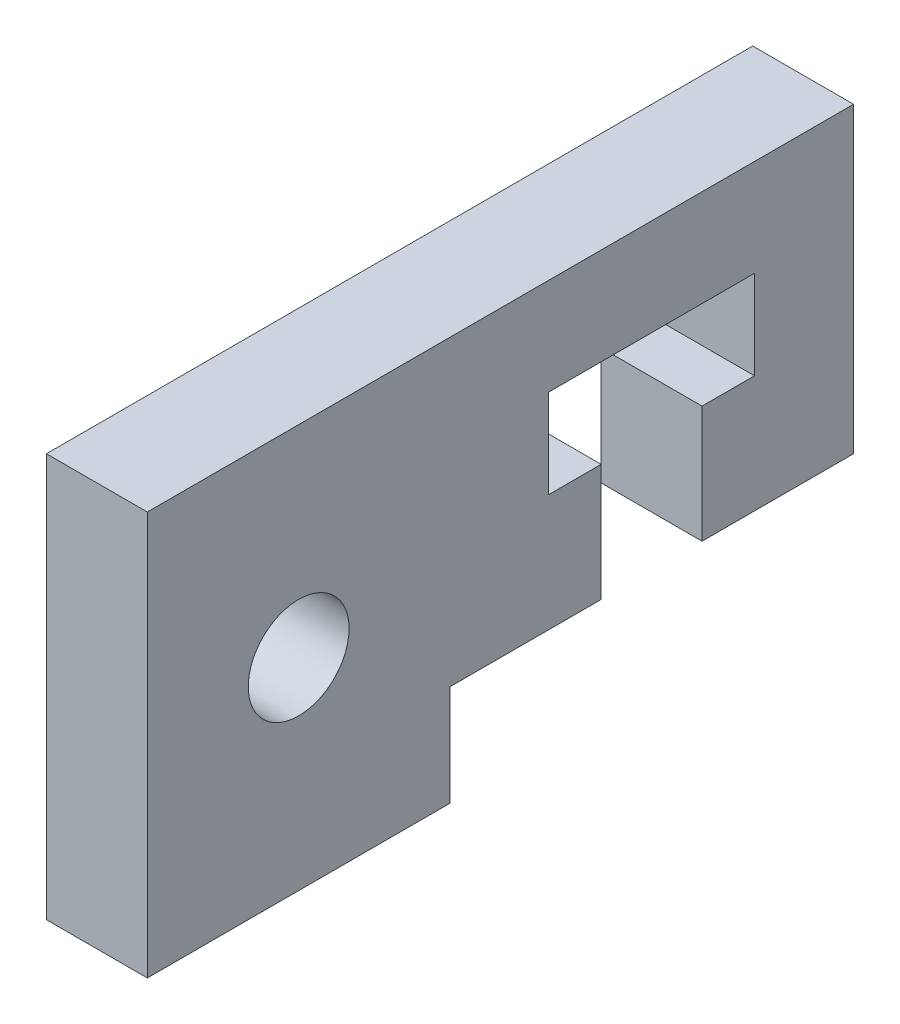
from build123d import *

# Parameters (mm, degrees)
BOSS_EXTRUDE1_DEPTH      = 1.5875
BOSS_EXTRUDE1_DEPTH_BACK = 1.5875
SKETCH2_R                = 1.5875


with BuildPart() as part:
    # Sketch2 → Boss-Extrude1 (new, two sides: drawn at the far end of the back side and taken through both)
    with BuildSketch(Plane(origin=(0, 0, 0), x_dir=(0, 0, -1), z_dir=(1, 0, 0)).offset(-BOSS_EXTRUDE1_DEPTH_BACK)):
        Polygon((-4.7625, 6.35), (-4.7625, -6.35), (4.7625, -6.35), (4.7625, -3.175), (9.51924613, -3.175), (9.51924613, 0.508), (7.86824613, 0.508), (7.86824613, 3.302), (14.34524613, 3.302), (14.34524613, 0.508), (12.69424613, 0.508), (12.69424613, -3.175), (17.4625, -3.175), (17.4625, 6.35), align=None)
        Circle(SKETCH2_R, mode=Mode.SUBTRACT)
    extrude(amount=BOSS_EXTRUDE1_DEPTH + BOSS_EXTRUDE1_DEPTH_BACK)


solid = part.part
